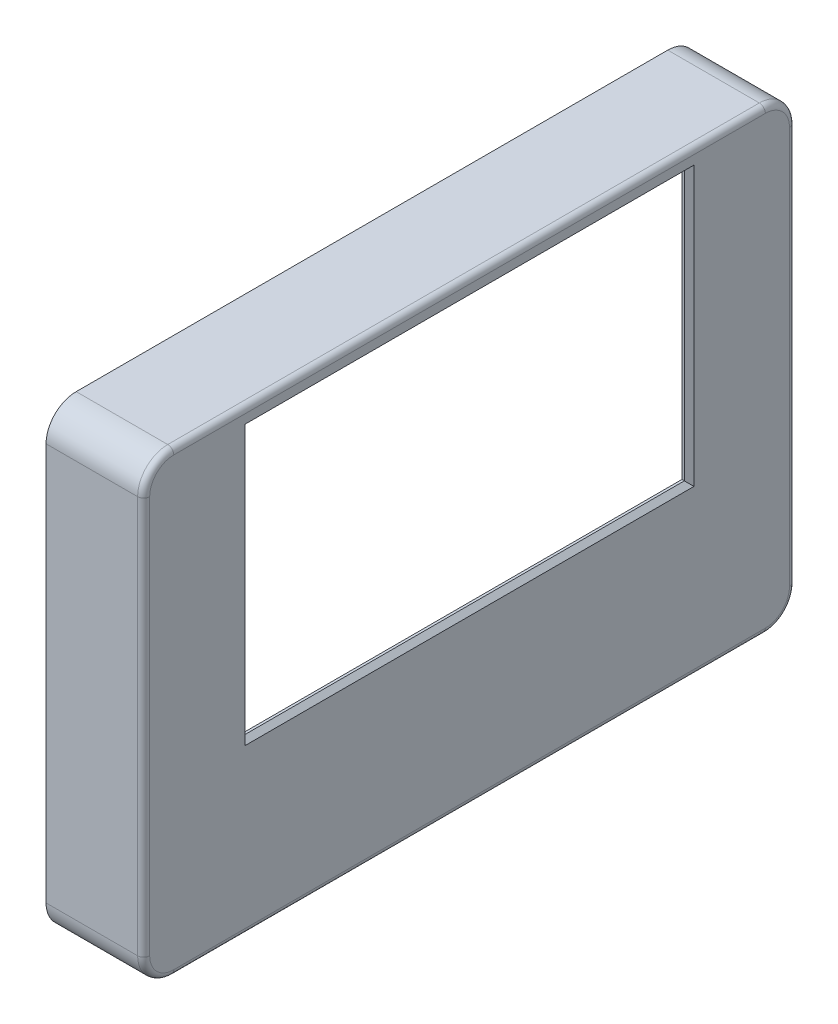
from build123d import *

# Parameters (mm, degrees)
BOSS_EXTRUDE1_DEPTH      = 1.2
BOSS_EXTRUDE1_DEPTH_BACK = 15
SKETCH2_W                = 76
SKETCH2_H                = 108.2
FILLET1_R                = 5
FILLET2_R                = 1
SHELL1_T                 = -1.65
SHELL1_THICKNESS_2_DEPTH = 0.45
SKETCH2_3_W              = 44.6
SKETCH2_3_H              = 72.9
CUT_EXTRUDE1_DEPTH       = 96.056864098
CHAMFER1_SIZE            = 0.8
SKETCH3_R                = 3
SKETCH3_R_2              = 1.5
BOSS_EXTRUDE2_DEPTH      = 4
FILLET3_R                = 1
FILLET4_R                = 0.4


with BuildPart() as part:
    # Sketch2 → Boss-Extrude1 (new, two sides: drawn at the far end of the back side and taken through both)
    with BuildSketch(Plane.YZ.offset(-BOSS_EXTRUDE1_DEPTH_BACK)):
        with Locations((-36.881555812, 2.5)):
            Rectangle(SKETCH2_W, SKETCH2_H)
    extrude(amount=BOSS_EXTRUDE1_DEPTH + BOSS_EXTRUDE1_DEPTH_BACK)

    # Fillet1
    fillet1_edges = [part.edges().sort_by_distance(p)[0] for p in [
        (-6.9, 1.118444188, -51.6),
        (-6.9, 1.118444188, 56.6),
        (-6.9, -74.881555812, 56.6),
        (-6.9, -74.881555812, -51.6),
    ]]
    fillet(fillet1_edges, radius=FILLET1_R)

    # Fillet2
    fillet2_edges = [part.edges().sort_by_distance(p)[0] for p in [
        (1.2, -74.881555812, 2.5),
        (1.2, -36.881555812, 56.6),
        (1.2, -36.881555812, -51.6),
        (1.2, 1.118444188, 2.5),
        (1.2, -0.346021906, 55.135533906),
        (1.2, -0.346021906, -50.135533906),
        (1.2, -73.417089718, -50.135533906),
        (1.2, -73.417089718, 55.135533906),
    ]]
    fillet(fillet2_edges, radius=FILLET2_R)

    # Shell1
    shell1_openings = [part.faces().sort_by_distance(p)[0] for p in [
        (-15, -36.881555812, 2.5),
    ]]
    offset(amount=SHELL1_T, openings=shell1_openings, kind=Kind.INTERSECTION)

    # Shell1 thickness 2 face (on inner face of the shell) → Shell1 thickness 2 (cut)
    with BuildSketch(Plane(origin=(-0.45, -36.881555812, 2.5), x_dir=(0, 0, 1), z_dir=(1, 0, 0))):
        with BuildLine():
            ThreePointArc((52.45, -33), (51.468807717, -35.368807717), (49.1, -36.35))
            Line((49.1, -36.35), (-49.1, -36.35))
            ThreePointArc((-49.1, -36.35), (-51.468807717, -35.368807717), (-52.45, -33))
            Line((-52.45, -33), (-52.45, 33))
            ThreePointArc((-52.45, 33), (-51.468807717, 35.368807717), (-49.1, 36.35))
            Line((-49.1, 36.35), (49.1, 36.35))
            ThreePointArc((49.1, 36.35), (51.468807717, 35.368807717), (52.45, 33))
            Line((52.45, 33), (52.45, -33))
        make_face()
    extrude(amount=SHELL1_THICKNESS_2_DEPTH, mode=Mode.SUBTRACT)

    # Sketch2<3> → Cut-Extrude1 (cut, through all)
    with BuildSketch(Plane.YZ):
        with Locations((-24.481555812, 2.5)):
            Rectangle(SKETCH2_3_W, SKETCH2_3_H)
    extrude(amount=CUT_EXTRUDE1_DEPTH, mode=Mode.SUBTRACT)

    # Chamfer1
    chamfer1_edges = [part.edges().sort_by_distance(p)[0] for p in [
        (1.2, -2.181555812, 2.5),
        (1.2, -24.481555812, 38.95),
        (1.2, -46.781555812, 2.5),
        (1.2, -24.481555812, -33.95),
    ]]
    chamfer(chamfer1_edges, length=CHAMFER1_SIZE)

    # Sketch3 → Boss-Extrude2 (add)
    # profile 1 of 4: a face of its own
    with BuildSketch(Plane(origin=(0, 0, 0), x_dir=(0, -1, 0), z_dir=(-1, 0, 0))):
        with Locations(Location((3.881555812, 44.3, 0), (0, 0, 270))):
            Circle(SKETCH3_R)
        with Locations(Location((3.881555812, 44.3, 0), (0, 0, 90))):
            Circle(SKETCH3_R_2, mode=Mode.SUBTRACT)
    # profile 2 of 4: a face of its own
    with BuildSketch(Plane(origin=(0, 0, 0), x_dir=(0, -1, 0), z_dir=(-1, 0, 0))):
        with Locations(Location((45.081555812, 44.3, 0), (0, 0, 270))):
            Circle(SKETCH3_R)
        with Locations(Location((45.081555812, 44.3, 0), (0, 0, 90))):
            Circle(SKETCH3_R_2, mode=Mode.SUBTRACT)
    # profile 3 of 4: a face of its own
    with BuildSketch(Plane(origin=(0, 0, 0), x_dir=(0, -1, 0), z_dir=(-1, 0, 0))):
        with Locations(Location((45.081555812, -44.3, 0), (0, 0, 270))):
            Circle(SKETCH3_R)
        with Locations(Location((45.081555812, -44.3, 0), (0, 0, 90))):
            Circle(SKETCH3_R_2, mode=Mode.SUBTRACT)
    # profile 4 of 4: a face of its own
    with BuildSketch(Plane(origin=(0, 0, 0), x_dir=(0, -1, 0), z_dir=(-1, 0, 0))):
        with Locations(Location((3.881555812, -44.3, 0), (0, 0, 270))):
            Circle(SKETCH3_R)
        with Locations(Location((3.881555812, -44.3, 0), (0, 0, 90))):
            Circle(SKETCH3_R_2, mode=Mode.SUBTRACT)
    extrude(amount=BOSS_EXTRUDE2_DEPTH)

    # Fillet3
    # the kernel refuses this fillet: 1 mm, written as the material it adds along each edge
    with BuildSketch(Plane(origin=(0, -3.881555812, 44.3), x_dir=(0, 0, -1), z_dir=(0, 1, 0))) as fillet3_piece_1:
        with BuildLine():
            CenterArc((3 + FILLET3_R, FILLET3_R), FILLET3_R, 180, 90)
            Line((3, FILLET3_R), (3, 0))
            Line((3, 0), (3 + FILLET3_R, 0))
        make_face()
    revolve(axis=Axis((0, -3.881555812, 44.3), (-1, 0, 0)))
    with BuildSketch(Plane(origin=(0, -45.081555812, -44.3), x_dir=(0, 0, -1), z_dir=(0, 1, 0))) as fillet3_piece_2:
        with BuildLine():
            CenterArc((3 + FILLET3_R, FILLET3_R), FILLET3_R, 180, 90)
            Line((3, FILLET3_R), (3, 0))
            Line((3, 0), (3 + FILLET3_R, 0))
        make_face()
    revolve(axis=Axis((0, -45.081555812, -44.3), (-1, 0, 0)))
    with BuildSketch(Plane(origin=(0, -3.881555812, -44.3), x_dir=(0, 0, -1), z_dir=(0, 1, 0))) as fillet3_piece_3:
        with BuildLine():
            CenterArc((3 + FILLET3_R, FILLET3_R), FILLET3_R, 180, 90)
            Line((3, FILLET3_R), (3, 0))
            Line((3, 0), (3 + FILLET3_R, 0))
        make_face()
    revolve(axis=Axis((0, -3.881555812, -44.3), (-1, 0, 0)))
    with BuildSketch(Plane(origin=(0, -45.081555812, 44.3), x_dir=(0, 0, -1), z_dir=(0, 1, 0))) as fillet3_piece_4:
        with BuildLine():
            CenterArc((3 + FILLET3_R, FILLET3_R), FILLET3_R, 180, 90)
            Line((3, FILLET3_R), (3, 0))
            Line((3, 0), (3 + FILLET3_R, 0))
        make_face()
    revolve(axis=Axis((0, -45.081555812, 44.3), (-1, 0, 0)))

    # Fillet4
    fillet4_edges = [part.edges().sort_by_distance(p)[0] for p in [
        (-4, -45.081555812, 47.3),
        (-4, -45.081555812, 42.8),
        (-4, -3.881555812, -41.3),
        (-4, -3.881555812, -45.8),
        (-4, -45.081555812, -41.3),
        (-4, -45.081555812, -45.8),
        (-4, -3.881555812, 47.3),
        (-4, -3.881555812, 42.8),
    ]]
    fillet(fillet4_edges, radius=FILLET4_R)


solid = part.part
